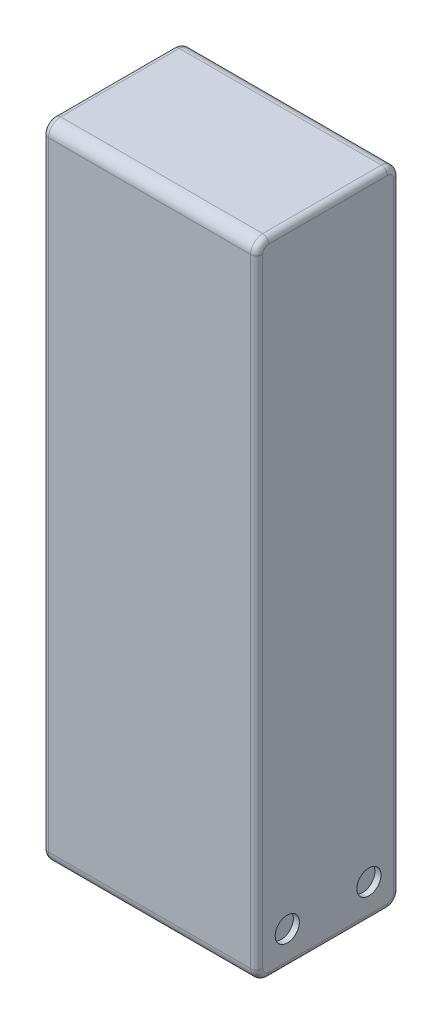
from build123d import *

# Parameters (mm, degrees)
SKETCH1_W           = 45
SKETCH1_H           = 30
BOSS_EXTRUDE1_DEPTH = 67.5
FILLET1_R           = 2.54
FILLET2_R           = 1.27
SKETCH2_R           = 2.54
CUT_EXTRUDE1_DEPTH  = 1.27


with BuildPart() as part:
    # Sketch1 → Boss-Extrude1 (new, symmetric)
    with BuildSketch(Plane(origin=(0, 0, 0), x_dir=(1, 0, 0), z_dir=(0, 1, 0))):
        Rectangle(SKETCH1_W, SKETCH1_H)
    extrude(amount=BOSS_EXTRUDE1_DEPTH, both=True)

    # Fillet1
    fillet1_edges = [part.edges().sort_by_distance(p)[0] for p in [
        (0, -67.5, 15),
        (0, -67.5, -15),
        (0, 67.5, 15),
        (0, 67.5, -15),
    ]]
    fillet(fillet1_edges, radius=FILLET1_R)

    # Fillet2
    fillet2_edges = [part.edges().sort_by_distance(p)[0] for p in [
        (-22.5, 66.756051224, -14.256051224),
        (-22.5, 67.5, 0),
        (-22.5, 66.756051224, 14.256051224),
        (-22.5, 0, 15),
        (-22.5, -66.756051224, 14.256051224),
        (-22.5, -67.5, 0),
        (-22.5, -66.756051224, -14.256051224),
        (22.5, 66.756051224, -14.256051224),
        (22.5, 67.5, 0),
        (22.5, 66.756051224, 14.256051224),
        (22.5, 0, 15),
        (22.5, -66.756051224, 14.256051224),
        (22.5, -67.5, 0),
        (22.5, -66.756051224, -14.256051224),
        (-22.5, 0, -15),
        (22.5, 0, -15),
    ]]
    fillet(fillet2_edges, radius=FILLET2_R)

    # Sketch2 → Cut-Extrude1 (cut)
    with BuildSketch(Plane(origin=(22.5, 0, 0), x_dir=(0, 0, -1), z_dir=(1, 0, 0))):
        with Locations((8.5725, -60.325)):
            Circle(SKETCH2_R)
        with Locations((-8.5725, -60.325)):
            Circle(SKETCH2_R)
    extrude(amount=-CUT_EXTRUDE1_DEPTH, mode=Mode.SUBTRACT)


solid = part.part
